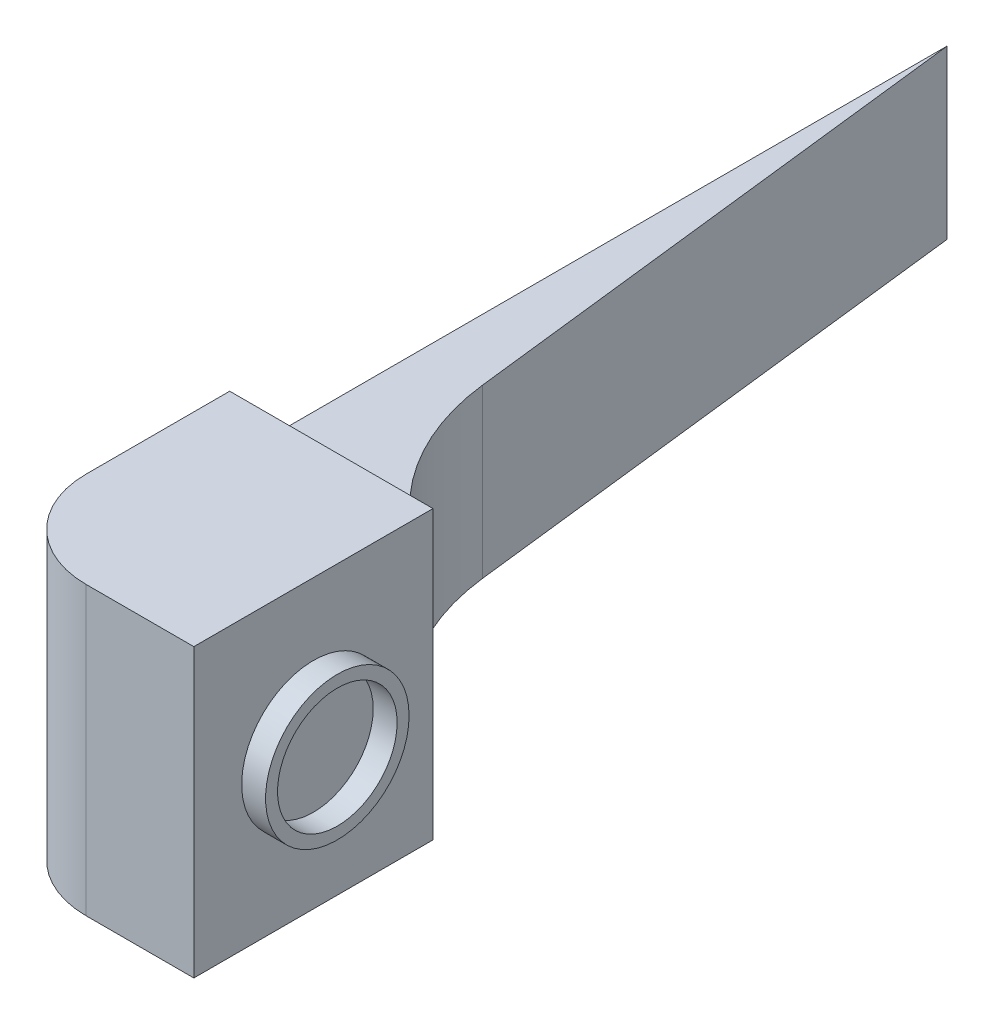
from build123d import *

# Parameters (mm, degrees)
BOSS_EXTRUDE1_DEPTH = 12
SKETCH2_W           = 30
SKETCH2_H           = 2.5
CUT_EXTRUDE1_DEPTH  = 10
FILLET1_R           = 10
FILLET2_R           = 4
SKETCH5_W           = 57.951370105
SKETCH5_H           = 2.5
CUT_EXTRUDE2_DEPTH  = 43.617484675
FILLET3_R           = 1
FILLET4_R           = 1
SKETCH6_R           = 3
SKETCH6_R_2         = 2.5
BOSS_EXTRUDE2_DEPTH = 1


with BuildPart() as part:
    # Sketch1 → Boss-Extrude1 (new body)
    with BuildSketch(Plane(origin=(0, 0, 0), x_dir=(1, 0, 0), z_dir=(0, 1, 0))):
        Polygon((10, 0), (1.5, 0), (1.5, 40), (5, 10), (10, 10), align=None)
    extrude(amount=BOSS_EXTRUDE1_DEPTH)

    # Sketch2 → Cut-Extrude1 (cut)
    with BuildSketch(Plane.ZY.offset(-1.5)):
        with Locations((-25, 1.25)):
            Rectangle(SKETCH2_W, SKETCH2_H)
    extrude(amount=-CUT_EXTRUDE1_DEPTH, mode=Mode.SUBTRACT)

    # Fillet1
    # the kernel refuses this fillet: 10 mm, written as the material it adds along each edge
    with BuildSketch(Plane(origin=(5, 2.5, -10), x_dir=(1, 0, 0), z_dir=(0, 1, 0))) as fillet1_piece_1:
        with BuildLine():
            CenterArc((8.998480528, 9.165814392), FILLET1_R, 186.654425046, 59.776895084)
            Line((-0.934150863, 8.007007396), (-1.132803491, 7.983831256))
            Line((-1.132803491, 7.983831256), (-0.198652628, -0.02317614))
            Line((-0.198652628, -0.02317614), (0, -0.2))
            ThreePointArc((0, -0.2), (2.5, -0.2), (4.920030389, -0.183316288))
            Line((4.920030389, -0.183316288), (5, 0))
        make_face()
    extrude(amount=9.5)

    # Fillet2
    fillet2_edges = [part.edges().sort_by_distance(p)[0] for p in [
        (1.5, 6, 0),
    ]]
    fillet(fillet2_edges, radius=FILLET2_R)

    # Sketch5 → Cut-Extrude2 (cut, through all)
    with BuildSketch(Plane(origin=(10, 0, 0), x_dir=(0, 0, -1), z_dir=(1, 0, 0))):
        with Locations((38.975685053, 10.75)):
            Rectangle(SKETCH5_W, SKETCH5_H)
    extrude(amount=-CUT_EXTRUDE2_DEPTH, mode=Mode.SUBTRACT)

    # Fillet3
    # the kernel refuses this fillet: 1 mm, written as the material it adds along each edge
    with BuildSketch(Plane(origin=(10, 9.5, -10), x_dir=(0, 1, 0), z_dir=(-1, 0, 0))) as fillet3_piece_1_section:
        with BuildLine():
            CenterArc((FILLET3_R, FILLET3_R), FILLET3_R, 180, 90)
            Line((0, FILLET3_R), (0, 0))
            Line((0, 0), (FILLET3_R, 0))
        make_face()
    fillet3_piece_1 = extrude(amount=8.5, mode=Mode.PRIVATE)
    fillet3_piece_1 = fillet3_piece_1 - Plane(origin=(13.998480528, 9.732981391, -19.165814392), x_dir=(1, 0, 0), z_dir=(0, -1, 0)) * Cylinder(10, 22, mode=Mode.PRIVATE)
    add(fillet3_piece_1)

    # Fillet4
    # the kernel refuses this fillet: 1 mm, written as the material it adds along each edge
    with BuildSketch(Plane(origin=(10, 2.5, -10), x_dir=(0, 0, -1), z_dir=(-1, 0, 0))) as fillet4_piece_1_section:
        with BuildLine():
            CenterArc((FILLET4_R, FILLET4_R), FILLET4_R, 180, 90)
            Line((0, FILLET4_R), (0, 0))
            Line((0, 0), (FILLET4_R, 0))
        make_face()
    fillet4_piece_1 = extrude(amount=8.5, mode=Mode.PRIVATE)
    fillet4_piece_1 = fillet4_piece_1 - Plane(origin=(13.998480528, 2.267019068, -19.165814392), x_dir=(1, 0, 0), z_dir=(0, -1, 0)) * Cylinder(10, 21, mode=Mode.PRIVATE)
    add(fillet4_piece_1)

    # Sketch6 → Boss-Extrude2 (add)
    with BuildSketch(Plane(origin=(10, 0, 0), x_dir=(0, 0, -1), z_dir=(1, 0, 0))):
        with Locations((5, 6)):
            Circle(SKETCH6_R)
        with Locations((5, 6)):
            Circle(SKETCH6_R_2, mode=Mode.SUBTRACT)
    extrude(amount=BOSS_EXTRUDE2_DEPTH)


solid = part.part
